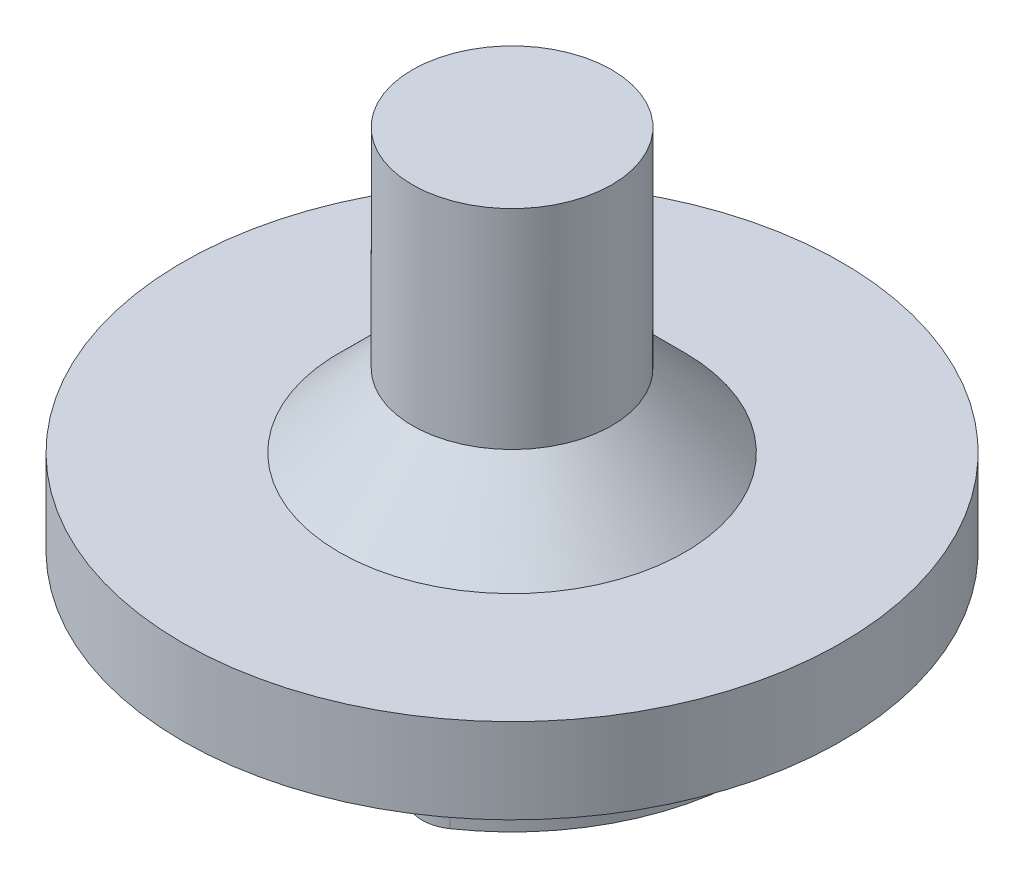
from build123d import *

# Parameters (mm, degrees)
ESQUISSE1_R        = 6.2
BOSS_EXTRU_1_DEPTH = 1.6
ESQUISSE2_R        = 1.875
BOSS_EXTRU_3_DEPTH = 5.3
ESQUISSE3_R        = 3.25
BOSS_EXTRU_5_DEPTH = 1.8
CHANFREIN2_SIZE    = 1.8
BOSS_EXTRU_6_DEPTH = 1.4


with BuildPart() as part:
    # Esquisse1 → Boss.-Extru.1 (new body)
    with BuildSketch(Plane(origin=(0, 0, 0), x_dir=(1, 0, 0), z_dir=(0, 1, 0))):
        with Locations(Location((0, 0, 0), (0, 0, 270))):
            Circle(ESQUISSE1_R)
    extrude(amount=BOSS_EXTRU_1_DEPTH)

    # Esquisse2 → Boss.-Extru.3 (add)
    with BuildSketch(Plane(origin=(0, 1.6, 0), x_dir=(1, 0, 0), z_dir=(0, 1, 0))):
        with Locations(Location((0, 0, 0), (0, 0, 270))):
            Circle(ESQUISSE2_R)
    extrude(amount=BOSS_EXTRU_3_DEPTH)

    # Esquisse3 → Boss.-Extru.5 (add)
    with BuildSketch(Plane(origin=(0, 1.6, 0), x_dir=(1, 0, 0), z_dir=(0, 1, 0))):
        with Locations(Location((0, 0, 0), (0, 0, 270))):
            Circle(ESQUISSE3_R)
    extrude(amount=BOSS_EXTRU_5_DEPTH)

    # Chanfrein2
    # the kernel refuses this chamfer: 1.8 mm, written as the material it takes off along each edge
    with BuildSketch(Plane(origin=(0, 3.4, 0), x_dir=(0, 0, 1), z_dir=(-1, 0, 0))) as chanfrein2_piece_1_section:
        Polygon((3.25, -CHANFREIN2_SIZE), (3.25 - CHANFREIN2_SIZE, 0), (3.25, 0), align=None)
    chanfrein2_piece_1 = revolve(axis=Axis((0, 3.4, 0), (0, 1, 0)), mode=Mode.PRIVATE)
    chanfrein2_piece_1 = split(chanfrein2_piece_1, bisect_by=Plane(origin=(0, 1.6, -2.584069467), z_dir=(0, 1, 0)), keep=Keep.TOP, mode=Mode.PRIVATE)
    chanfrein2_piece_1 = chanfrein2_piece_1 - Plane(origin=(0, 2.309069467, 0), x_dir=(0, 0, 1), z_dir=(0, -1, 0)) * Cylinder(1.875, 13, mode=Mode.PRIVATE)
    add(chanfrein2_piece_1, mode=Mode.SUBTRACT)

    # Esquisse4 → Boss.-Extru.6 (add)
    with BuildSketch(Plane.XZ):
        with BuildLine():
            ThreePointArc((0, -4.5), (2.098884425, -3.980538176), (3.71319537, -2.542081853))
            ThreePointArc((3.71319537, -2.542081853), (3.531022156, -1.569038729), (2.557979032, -1.751211943))
            ThreePointArc((2.557979032, -1.751211943), (1.44589816, -2.742148521), (0, -3.1))
            ThreePointArc((0, -3.1), (-0.7, -3.8), (0, -4.5))
        make_face()
        with BuildLine():
            ThreePointArc((3.1, 0), (3.8, -0.7), (4.5, 0))
            ThreePointArc((4.5, 0), (3.980538176, 2.098884425), (2.542081853, 3.71319537))
            ThreePointArc((2.542081853, 3.71319537), (1.569038729, 3.531022156), (1.751211943, 2.557979032))
            ThreePointArc((1.751211943, 2.557979032), (2.742148521, 1.44589816), (3.1, 0))
        make_face()
        with BuildLine():
            ThreePointArc((-4.5, 0), (-3.980538176, -2.098884425), (-2.542081853, -3.71319537))
            ThreePointArc((-2.542081853, -3.71319537), (-1.569038729, -3.531022156), (-1.751211943, -2.557979032))
            ThreePointArc((-1.751211943, -2.557979032), (-2.742148521, -1.44589816), (-3.1, 0))
            ThreePointArc((-3.1, 0), (-3.8, 0.7), (-4.5, 0))
        make_face()
        with BuildLine():
            ThreePointArc((0, 3.1), (0.7, 3.8), (0, 4.5))
            ThreePointArc((0, 4.5), (-2.098884425, 3.980538176), (-3.71319537, 2.542081853))
            ThreePointArc((-3.71319537, 2.542081853), (-3.531022156, 1.569038729), (-2.557979032, 1.751211943))
            ThreePointArc((-2.557979032, 1.751211943), (-1.44589816, 2.742148521), (0, 3.1))
        make_face()
    extrude(amount=BOSS_EXTRU_6_DEPTH)


solid = part.part
